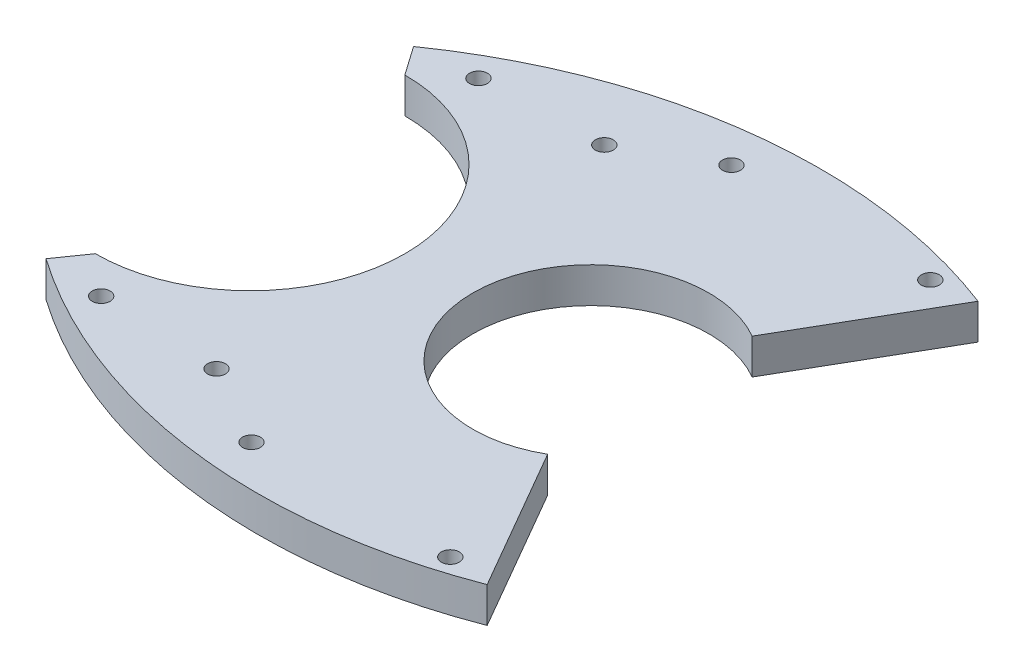
from build123d import *

# Parameters (mm, degrees)
SKETCH2_R           = 2.413
BOSS_EXTRUDE1_DEPTH = 4.7625


with BuildPart() as part:
    # Sketch2 → Boss-Extrude1 (new, symmetric)
    with BuildSketch(Plane(origin=(0, 0, 0), x_dir=(1, 0, 0), z_dir=(0, 1, 0))):
        with BuildLine():
            Line((78.375, 27.49630657), (100.6, 65.991135768))
            ThreePointArc((100.6, 65.991135768), (30.932300959, 74.564428505), (-34.600998523, 49.415347072))
            Line((-34.600998523, 49.415347072), (-29.137682967, 41.61292385))
            ThreePointArc((-29.137682967, 41.61292385), (12.5, 0), (-29.137682967, -41.61292385))
            Line((-29.137682967, -41.61292385), (-34.600998523, -49.415347072))
            ThreePointArc((-34.600998523, -49.415347072), (30.932300959, -74.564428505), (100.6, -65.991135768))
            Line((100.6, -65.991135768), (78.375, -27.49630657))
            ThreePointArc((78.375, -27.49630657), (30.75, 0), (78.375, 27.49630657))
        make_face()
        with Locations((-18.460537236, 50.719909207)):
            Circle(SKETCH2_R, mode=Mode.SUBTRACT)
        with Locations((13.969757959, 52.135846474)):
            Circle(SKETCH2_R, mode=Mode.SUBTRACT)
        with Locations((35.769562249, 64.532985346)):
            Circle(SKETCH2_R, mode=Mode.SUBTRACT)
        with Locations((89.230437751, 64.532985346)):
            Circle(SKETCH2_R, mode=Mode.SUBTRACT)
        with Locations((89.230437751, -64.532985346)):
            Circle(SKETCH2_R, mode=Mode.SUBTRACT)
        with Locations((35.769562249, -64.532985346)):
            Circle(SKETCH2_R, mode=Mode.SUBTRACT)
        with Locations((13.969757959, -52.135846474)):
            Circle(SKETCH2_R, mode=Mode.SUBTRACT)
        with Locations((-18.460537236, -50.719909207)):
            Circle(SKETCH2_R, mode=Mode.SUBTRACT)
    extrude(amount=BOSS_EXTRUDE1_DEPTH, both=True)


solid = part.part
